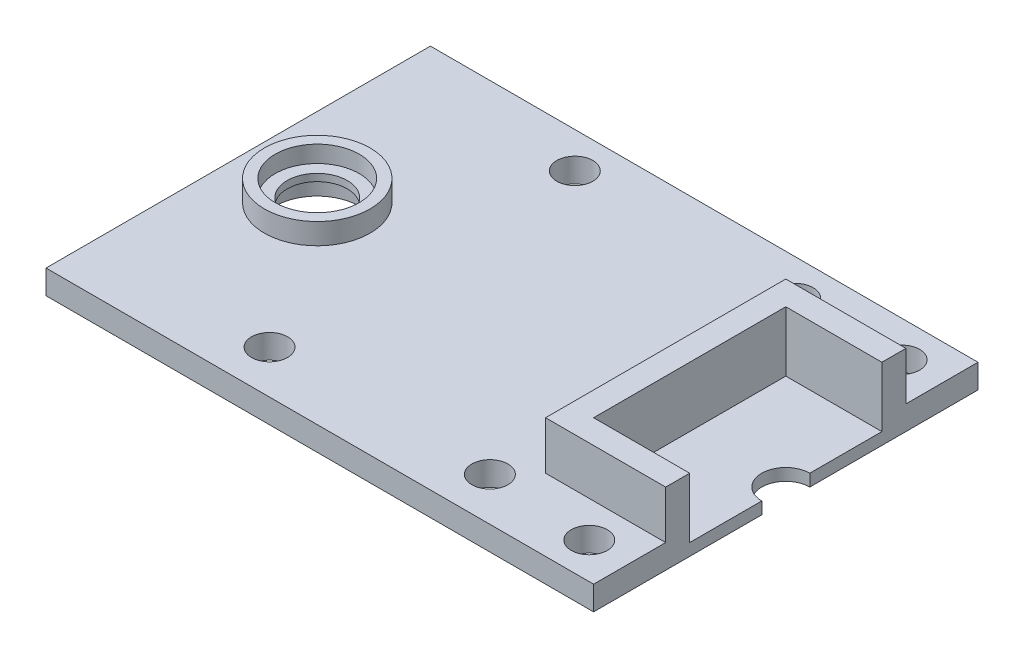
from build123d import *

# Parameters (mm, degrees)
SKETCH1_W               = 279.4
SKETCH1_H               = 101.6
BOSS_EXTRUDE1_DEPTH     = 6.35
SKETCH2_R               = 13.97
BOSS_EXTRUDE3_DEPTH     = 5.55625
SKETCH9_R               = 11.1125
CUT_EXTRUDE4_DEPTH      = 4.445
CUT_EXTRUDE5_START      = -5.55625
SKETCH10_R              = 11.1125
CUT_EXTRUDE5_DEPTH      = 5.55625
SKETCH11_R              = 7.9375
CUT_EXTRUDE6_DEPTH      = 285.078633923
SKETCH12_R              = 6.35
CUT_EXTRUDE7_DEPTH      = 285.051619429
SKETCH22_W              = 63.5
SKETCH22_H              = 63.5
BOSS_EXTRUDE7_DEPTH     = 12.7
SKETCH25_W              = 50.8
SKETCH25_H              = 50.8
CUT_EXTRUDE11_DEPTH     = 15.875
SKETCH32_R              = 4.7625
CUT_EXTRUDE12_DEPTH     = 6.35
SKETCH38_W              = 46.99
SKETCH38_H              = 18.470251096
CUT_EXTRUDE13_DEPTH     = 6.35
SKETCH60_R              = 4.7625
CUT_EXTRUDE23_DEPTH     = 6.35
CUT_EXTRUDE24_START     = -6.35
CUT_EXTRUDE24_OUTLINE_R = 4.7625
CUT_EXTRUDE24_DEPTH     = 19.05
SKETCH62_R              = 4.7625
CUT_EXTRUDE25_DEPTH     = 285.264471927


# Read off the part's stored shape, not the designer's step: Cut-Extrude24
with BuildPart() as part:
    # Sketch1 → Boss-Extrude1 (new body)
    with BuildSketch(Plane(origin=(0, 0, 0), x_dir=(1, 0, 0), z_dir=(0, 1, 0))):
        with Locations((-139.7, 0)):
            Rectangle(SKETCH1_W, SKETCH1_H)
    extrude(amount=BOSS_EXTRUDE1_DEPTH)

    # Sketch2 → Boss-Extrude3 (add)
    with BuildSketch(Plane(origin=(0, 6.35, 0), x_dir=(1, 0, 0), z_dir=(0, 1, 0))):
        with Locations(Location((-258.510557857, 0, 0), (0, 0, 90))):
            Circle(SKETCH2_R)
    extrude(amount=BOSS_EXTRUDE3_DEPTH)

    # Sketch9 → Cut-Extrude4 (cut)
    with BuildSketch(Plane(origin=(0, 11.90625, 0), x_dir=(1, 0, 0), z_dir=(0, 1, 0))):
        with Locations(Location((-258.510557857, 0, 0), (0, 0, 270))):
            Circle(SKETCH9_R)
    extrude(amount=-CUT_EXTRUDE4_DEPTH, mode=Mode.SUBTRACT)

    # Sketch10 → Cut-Extrude5 (cut)
    with BuildSketch(Plane(origin=(0, 0, 0), x_dir=(-1, 0, 0), z_dir=(0, -1, 0)).offset(CUT_EXTRUDE5_START)):
        with Locations(Location((258.510557857, 0, 0), (0, 0, 270))):
            Circle(SKETCH10_R)
    extrude(amount=CUT_EXTRUDE5_DEPTH, mode=Mode.SUBTRACT)

    # Sketch11 → Cut-Extrude6 (cut, through all)
    with BuildSketch(Plane(origin=(0, 7.46125, 0), x_dir=(1, 0, 0), z_dir=(0, 1, 0))):
        with Locations(Location((-258.510557857, 0, 0), (0, 0, 270))):
            Circle(SKETCH11_R)
    extrude(amount=-CUT_EXTRUDE6_DEPTH, mode=Mode.SUBTRACT)

    # Sketch12 → Cut-Extrude7 (cut, through all)
    with BuildSketch(Plane(origin=(0, 6.35, 0), x_dir=(1, 0, 0), z_dir=(0, 1, 0))):
        with Locations(Location((-134.666203771, 0, 0), (0, 0, 270))):
            Circle(SKETCH12_R)
    extrude(amount=-CUT_EXTRUDE7_DEPTH, mode=Mode.SUBTRACT)

    # Sketch22 → Boss-Extrude7 (add)
    with BuildSketch(Plane(origin=(0, 6.35, 0), x_dir=(1, 0, 0), z_dir=(0, 1, 0))):
        with Locations((-134.666203771, 0)):
            Rectangle(SKETCH22_W, SKETCH22_H)
    extrude(amount=BOSS_EXTRUDE7_DEPTH)

    # Sketch25 → Cut-Extrude11 (cut)
    with BuildSketch(Plane(origin=(0, 19.05, 0), x_dir=(1, 0, 0), z_dir=(0, 1, 0))):
        with Locations((-134.666203771, 0)):
            Rectangle(SKETCH25_W, SKETCH25_H)
    extrude(amount=-CUT_EXTRUDE11_DEPTH, mode=Mode.SUBTRACT)

    # Sketch32 → Cut-Extrude12 (cut)
    with BuildSketch(Plane(origin=(0, 6.35, 0), x_dir=(1, 0, 0), z_dir=(0, 1, 0))):
        with Locations(Location((-67.44195898, -40.64, 0), (0, 0, 270))):
            Circle(SKETCH32_R)
        with Locations(Location((-81.41195898, -40.64, 0), (0, 0, 270))):
            Circle(SKETCH32_R)
        with Locations(Location((-67.44195898, 40.64, 0), (0, 0, 270))):
            Circle(SKETCH32_R)
        with Locations(Location((-81.41195898, 40.64, 0), (0, 0, 270))):
            Circle(SKETCH32_R)
    extrude(amount=-CUT_EXTRUDE12_DEPTH, mode=Mode.SUBTRACT)

    # Sketch38 → Cut-Extrude13 (cut)
    with BuildSketch(Plane(origin=(0, 6.35, 0), x_dir=(1, 0, 0), z_dir=(0, 1, 0))):
        with Locations((-23.495, -24.777709652)):
            Rectangle(SKETCH38_W, SKETCH38_H)
    extrude(amount=-CUT_EXTRUDE13_DEPTH, mode=Mode.SUBTRACT)

    # Sketch60 → Cut-Extrude23 (cut)
    with BuildSketch(Plane(origin=(0, 6.35, 0), x_dir=(1, 0, 0), z_dir=(0, 1, 0))):
        with Locations(Location((-231.7492444, 41.324145444, 0), (0, 0, 270))):
            Circle(SKETCH60_R)
        with Locations(Location((-231.7492444, -39.369341378, 0), (0, 0, 270))):
            Circle(SKETCH60_R)
        with Locations(Location((-173.509244294, -39.369341378, 0), (0, 0, 270))):
            Circle(SKETCH60_R)
        with Locations(Location((-173.509244294, 41.324145444, 0), (0, 0, 270))):
            Circle(SKETCH60_R)
    extrude(amount=-CUT_EXTRUDE23_DEPTH, mode=Mode.SUBTRACT)

    # Cut-Extrude24 outline → Cut-Extrude24 (cut)
    with BuildSketch(Plane(origin=(0, 6.35, 0), x_dir=(1, 0, 0), z_dir=(0, 1, 0)).offset(CUT_EXTRUDE24_START)):
        with BuildLine():
            Line((-134.666203771, -50.8), (0, -50.8))
            Line((0, -50.8), (0, -34.0128352))
            Line((0, -34.0128352), (-46.99, -34.0128352))
            Line((-46.99, -34.0128352), (-46.99, -15.542584104))
            Line((-46.99, -15.542584104), (0, -15.542584104))
            Line((0, -15.542584104), (0, 50.8))
            Line((0, 50.8), (-134.666203771, 50.8))
            Line((-134.666203771, 50.8), (-134.666203771, 6.35))
            ThreePointArc((-134.666203771, 6.35), (-128.316203771, 0), (-134.666203771, -6.35))
            Line((-134.666203771, -6.35), (-134.666203771, -50.8))
        make_face()
        with Locations((-81.41195898, -40.64)):
            Circle(CUT_EXTRUDE24_OUTLINE_R, mode=Mode.SUBTRACT)
        with Locations((-67.44195898, -40.64)):
            Circle(CUT_EXTRUDE24_OUTLINE_R, mode=Mode.SUBTRACT)
        with Locations((-81.41195898, 40.64)):
            Circle(CUT_EXTRUDE24_OUTLINE_R, mode=Mode.SUBTRACT)
        with Locations((-67.44195898, 40.64)):
            Circle(CUT_EXTRUDE24_OUTLINE_R, mode=Mode.SUBTRACT)
    extrude(amount=CUT_EXTRUDE24_DEPTH, mode=Mode.SUBTRACT)

    # Sketch62 → Cut-Extrude25 (cut, through all)
    with BuildSketch(Plane(origin=(0, 6.35, 0), x_dir=(1, 0, 0), z_dir=(0, 1, 0))):
        with Locations(Location((-145.334203771, 41.275, 0), (0, 0, 270))):
            Circle(SKETCH62_R)
    cut_extrude25 = extrude(amount=-CUT_EXTRUDE25_DEPTH, mode=Mode.SUBTRACT)

    # Mirror1: Cut-Extrude25 across plane
    add(cut_extrude25.mirror(Plane.XY), mode=Mode.SUBTRACT)


solid = part.part
